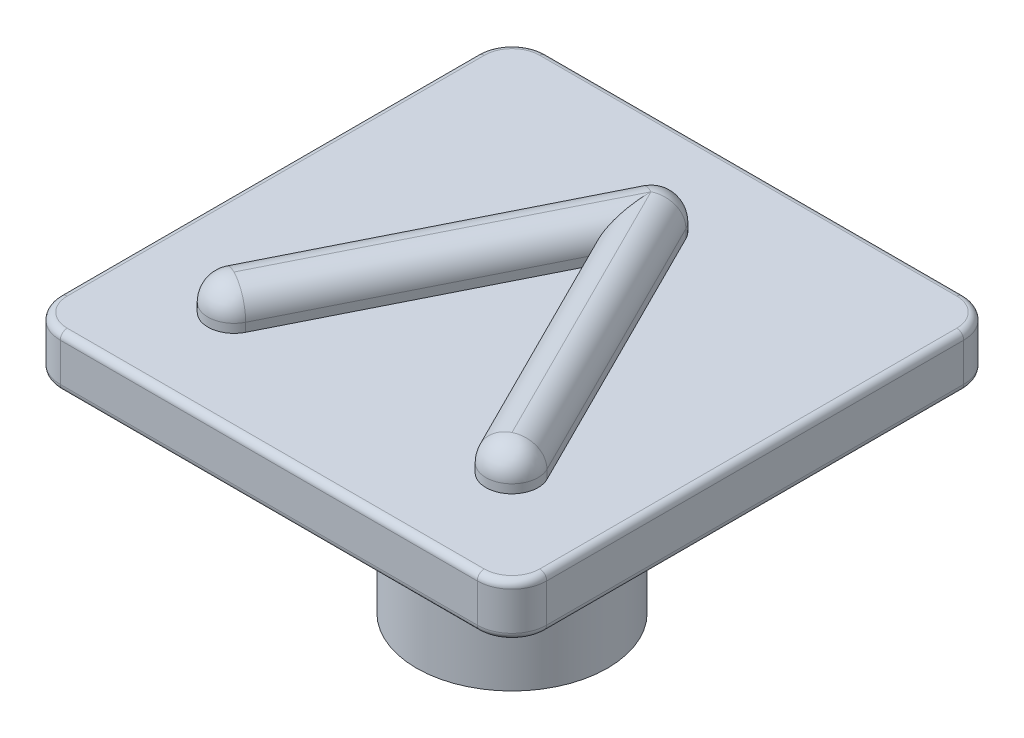
from build123d import *

# Parameters (mm, degrees)
BOSS_EXTRUDE1_DEPTH = 1.5
SKETCH2_R           = 2.75
BOSS_EXTRUDE2_DEPTH = 6
SKETCH3_W           = 1.1
SKETCH3_H           = 1.45
SKETCH3_W_2         = 1.45
SKETCH3_H_2         = 1.1
CUT_EXTRUDE1_DEPTH  = 6
CHAMFER1_SIZE       = 0.3
FILLET1_R           = 1
FILLET3_R           = 0.2
BOSS_EXTRUDE3_DEPTH = 1
FILLET6_R           = 0.75


with BuildPart() as part:
    # Sketch1 → Boss-Extrude1 (new body)
    with BuildSketch(Plane(origin=(0, 0, 0), x_dir=(1, 0, 0), z_dir=(0, 1, 0))):
        with BuildLine():
            Line((-7.324675649, 4.396717546), (4.675324351, 4.396717546))
            ThreePointArc((4.675324351, 4.396717546), (5.382431132, 4.103824327), (5.675324351, 3.396717546))
            Line((5.675324351, 3.396717546), (5.675324351, -8.603282454))
            ThreePointArc((5.675324351, -8.603282454), (5.382431132, -9.310389235), (4.675324351, -9.603282454))
            Line((4.675324351, -9.603282454), (-7.324675649, -9.603282454))
            ThreePointArc((-7.324675649, -9.603282454), (-8.03178243, -9.310389235), (-8.324675649, -8.603282454))
            Line((-8.324675649, -8.603282454), (-8.324675649, 3.396717546))
            ThreePointArc((-8.324675649, 3.396717546), (-8.03178243, 4.103824327), (-7.324675649, 4.396717546))
        make_face()
    extrude(amount=BOSS_EXTRUDE1_DEPTH)

    # Sketch2 → Boss-Extrude2 (add)
    with BuildSketch(Plane.XZ):
        with Locations(Location((-1.324675649, 2.603282454, 0), (0, 0, 270))):
            Circle(SKETCH2_R)
    extrude(amount=BOSS_EXTRUDE2_DEPTH)

    # Sketch3 → Cut-Extrude1 (cut)
    with BuildSketch(Plane.XZ.offset(6)):
        with Locations((-1.324675649, 3.878282454)):
            Rectangle(SKETCH3_W, SKETCH3_H)
        with Locations((-0.049675649, 2.603282454)):
            Rectangle(SKETCH3_W_2, SKETCH3_H_2)
        with Locations((-1.324675649, 2.603282454)):
            Rectangle(SKETCH3_W, SKETCH3_H_2)
        with Locations((-2.599675649, 2.603282454)):
            Rectangle(SKETCH3_W_2, SKETCH3_H_2)
        with Locations((-1.324675649, 1.328282454)):
            Rectangle(SKETCH3_W, SKETCH3_H)
    extrude(amount=-CUT_EXTRUDE1_DEPTH, mode=Mode.SUBTRACT)

    # Chamfer1
    chamfer1_edges = [part.edges().sort_by_distance(p)[0] for p in [
        (-0.774675649, -6, 3.878282454),
        (-0.049675649, -6, 3.153282454),
        (0.675324351, -6, 2.603282454),
        (-0.774675649, -6, 1.328282454),
        (-2.599675649, -6, 3.153282454),
        (-1.324675649, -6, 4.603282454),
        (-1.874675649, -6, 3.878282454),
        (-3.324675649, -6, 2.603282454),
        (-2.599675649, -6, 2.053282454),
        (-1.874675649, -6, 1.328282454),
        (-1.324675649, -6, 0.603282454),
        (-0.049675649, -6, 2.053282454),
    ]]
    chamfer(chamfer1_edges, length=CHAMFER1_SIZE)

    # Fillet1
    fillet1_edges = [part.edges().sort_by_distance(p)[0] for p in [
        (-1.324675649, 0, 5.353282454),
    ]]
    fillet(fillet1_edges, radius=FILLET1_R)

    # Fillet3
    fillet3_edges = [part.edges().sort_by_distance(p)[0] for p in [
        (5.382431132, 1.5, 9.310389235),
        (-1.324675649, 0, 9.603282454),
        (-8.03178243, 0, 9.310389235),
        (5.675324351, 1.5, 2.603282454),
        (5.382431132, 1.5, -4.103824327),
        (-1.324675649, 1.5, -4.396717546),
        (-8.03178243, 1.5, -4.103824327),
        (-8.324675649, 1.5, 2.603282454),
        (-8.03178243, 1.5, 9.310389235),
        (-1.324675649, 1.5, 9.603282454),
        (-8.324675649, 0, 2.603282454),
        (-8.03178243, 0, -4.103824327),
        (-1.324675649, 0, -4.396717546),
        (5.382431132, 0, -4.103824327),
        (5.675324351, 0, 2.603282454),
        (5.382431132, 0, 9.310389235),
    ]]
    fillet(fillet3_edges, radius=FILLET3_R)

    # Sketch4 → Boss-Extrude3 (add)
    with BuildSketch(Plane(origin=(0, 1.5, 0), x_dir=(1, 0, 0), z_dir=(0, 1, 0))):
        with BuildLine():
            ThreePointArc((-0.653855256, 1.732127742), (-0.574675649, 1.396717546), (-0.653855256, 1.061307349))
            Line((-0.653855256, 1.061307349), (-1.324675649, -0.280333437))
            Line((-1.324675649, -0.280333437), (2.004503957, -6.938692651))
            ThreePointArc((2.004503957, -6.938692651), (3.010734547, -7.274102848), (3.346144744, -6.267872258))
            Line((3.346144744, -6.267872258), (-0.653855256, 1.732127742))
        make_face()
        with BuildLine():
            Line((-1.324675649, -0.280333437), (-0.653855256, 1.061307349))
            ThreePointArc((-0.653855256, 1.061307349), (-0.574675649, 1.396717546), (-0.653855256, 1.732127742))
            ThreePointArc((-0.653855256, 1.732127742), (-1.324675649, 2.146717546), (-1.995496043, 1.732127742))
            ThreePointArc((-1.995496043, 1.732127742), (-2.074675649, 1.396717546), (-1.995496043, 1.061307349))
            Line((-1.995496043, 1.061307349), (-1.324675649, -0.280333437))
        make_face()
        with BuildLine():
            Line((-4.653855256, -6.938692651), (-1.324675649, -0.280333437))
            Line((-1.324675649, -0.280333437), (-1.995496043, 1.061307349))
            ThreePointArc((-1.995496043, 1.061307349), (-2.074675649, 1.396717546), (-1.995496043, 1.732127742))
            Line((-1.995496043, 1.732127742), (-5.995496043, -6.267872258))
            ThreePointArc((-5.995496043, -6.267872258), (-5.660085846, -7.274102848), (-4.653855256, -6.938692651))
        make_face()
    extrude(amount=BOSS_EXTRUDE3_DEPTH)

    # Fillet6
    fillet6_edges = [part.edges().sort_by_distance(p)[0] for p in [
        (1.346144744, 2.5, 2.267872258),
        (-2.989265453, 2.5, 3.609513044),
        (-1.324675649, 2.5, -2.146717546),
        (-3.995496043, 2.5, 2.267872258),
        (-5.660085846, 2.5, 7.274102848),
        (0.339914154, 2.5, 3.609513044),
        (3.010734547, 2.5, 7.274102848),
    ]]
    fillet(fillet6_edges, radius=FILLET6_R - 0.0001)  # a hair under: the kernel refuses the full size


solid = part.part
